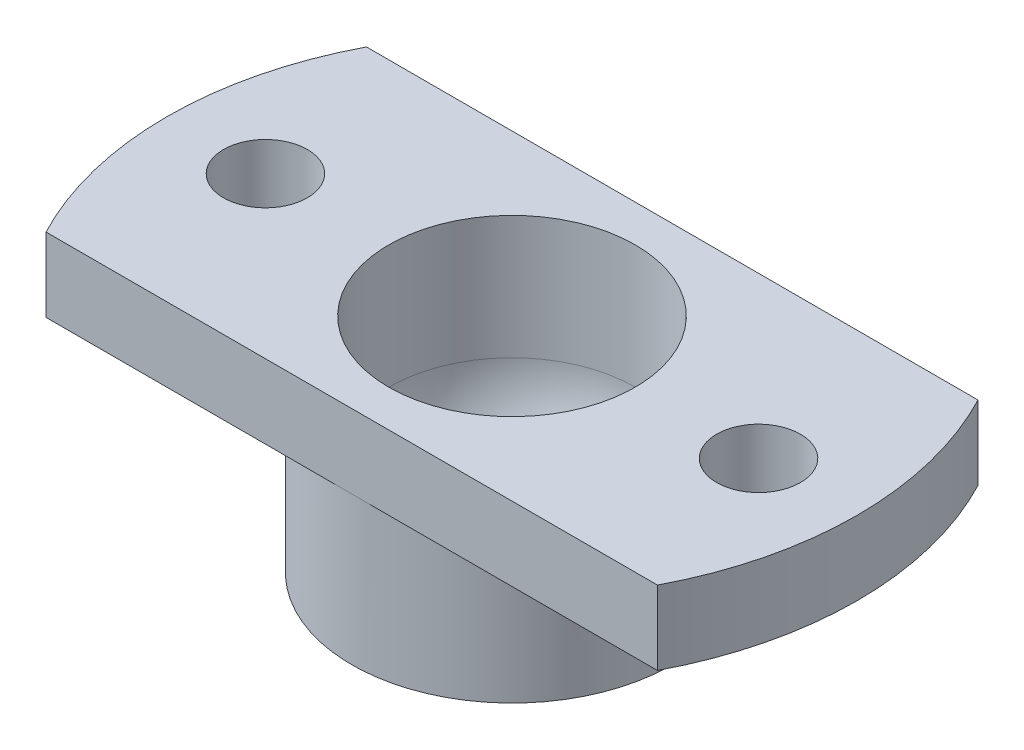
from build123d import *

# Parameters (mm, degrees)
CIRPATTERN2_COUNT  = 2
SKETCH5_W          = 50.426982916
SKETCH5_H          = 33.50460585
SKETCH5_W_2        = 37.991098709
SKETCH5_H_2        = 13
CUT_EXTRUDE1_DEPTH = 21.688160866


with BuildPart() as part:
    # Sketch1 → Revolve1 (revolve)
    with BuildSketch(Plane(origin=(0, 0, 0), x_dir=(0, 0, -1), z_dir=(1, 0, 0))):
        with BuildLine():
            Line((-14, 5), (-5, 5))
            Line((-5, 5), (-5, 0))
            ThreePointArc((-5, 0), (-4.472135955, -2.236067977), (-3, -4))
            Line((-3, -4), (-6.5, -4))
            Line((-6.5, -4), (-6.5, 2))
            Line((-6.5, 2), (-14, 2))
            Line((-14, 2), (-14, 5))
        make_face()
    revolve(axis=Axis((0, 0, 0), (0, 1, 0)))

    # Sketch3 → M3 Clearance Hole1 (revolve, cut)
    with BuildSketch(Plane(origin=(-10, 2, 0), x_dir=(0, 0, -1), z_dir=(1, 0, 0))):
        Polygon((0, 0), (0, 11.021463052), (1.7, 10), (1.7, 0), align=None)
    m3_clearance_hole1 = revolve(axis=Axis((-10, -4.35, 0), (0, 1, 0)), mode=Mode.SUBTRACT)

    # CirPattern2: M3 Clearance Hole1 ×2 about axis
    cirpattern2_axis = Axis((0, 0, 0), (0, 1, 0))
    for i in range(1, CIRPATTERN2_COUNT):
        add(m3_clearance_hole1.rotate(cirpattern2_axis, i * 360 / CIRPATTERN2_COUNT), mode=Mode.SUBTRACT)

    # Sketch5 → Cut-Extrude1 (cut, through all)
    with BuildSketch(Plane.XZ.offset(-2)):
        with Locations((1.488148737, 1.020444848)):
            Rectangle(SKETCH5_W, SKETCH5_H)
        with Locations((1.919239442, 0)):
            Rectangle(SKETCH5_W_2, SKETCH5_H_2, mode=Mode.SUBTRACT)
    extrude(amount=-CUT_EXTRUDE1_DEPTH, mode=Mode.SUBTRACT)


solid = part.part
